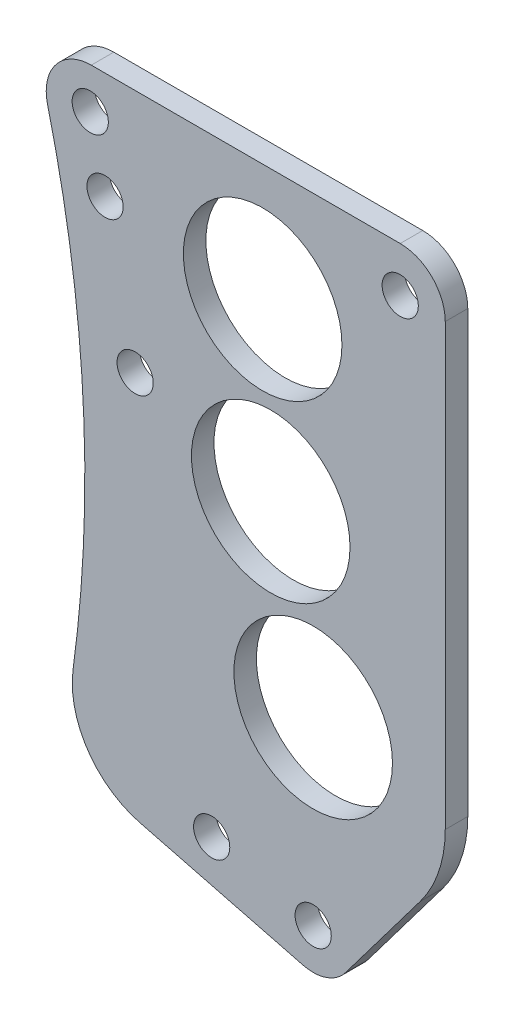
from build123d import *

# Parameters (mm, degrees)
SKETCH2_R           = 2.5527
SKETCH2_R_2         = 11.176
BOSS_EXTRUDE1_DEPTH = 3.175


with BuildPart() as part:
    # Sketch2 → Boss-Extrude1 (new body)
    with BuildSketch(Plane.XY):
        with BuildLine():
            Line((89.804840449, 162.158224077), (133.35, 162.158224077))
            ThreePointArc((133.35, 162.158224077), (137.840128061, 160.298352138), (139.7, 155.808224077))
            Line((139.7, 155.808224077), (139.7, 93.800599977))
            ThreePointArc((139.7, 93.800599977), (138.794482451, 88.24423856), (136.171639749, 83.262892317))
            Line((136.171639749, 83.262892317), (125.655155155, 69.319391612))
            ThreePointArc((125.655155155, 69.319391612), (122.975635879, 67.362639494), (119.660773298, 67.219851313))
            Line((119.660773298, 67.219851313), (96.672878026, 73.109258508))
            ThreePointArc((96.672878026, 73.109258508), (89.283742308, 78.328372298), (87.243120334, 87.141676865))
            ThreePointArc((87.243120334, 87.141676865), (88.644839635, 120.88029943), (83.642604572, 154.275465457))
            ThreePointArc((83.642604572, 154.275465457), (84.802065357, 159.719073266), (89.804840449, 162.158224077))
        make_face()
        with Locations((89.657841737, 156.395094021)):
            Circle(SKETCH2_R, mode=Mode.SUBTRACT)
        with Locations((91.747700228, 147.102187237)):
            Circle(SKETCH2_R, mode=Mode.SUBTRACT)
        with Locations((106.775437357, 76.433708644)):
            Circle(SKETCH2_R, mode=Mode.SUBTRACT)
        with Locations((115.1001, 121.545060726)):
            Circle(SKETCH2_R_2, mode=Mode.SUBTRACT)
        with Locations((113.962375762, 145.648224077)):
            Circle(SKETCH2_R_2, mode=Mode.SUBTRACT)
        with Locations((133.35, 155.808224077)):
            Circle(SKETCH2_R, mode=Mode.SUBTRACT)
        with Locations((95.988414932, 127.701170501)):
            Circle(SKETCH2_R, mode=Mode.SUBTRACT)
        with Locations((121.082277384, 72.768353221)):
            Circle(SKETCH2_R, mode=Mode.SUBTRACT)
        with Locations((121.082277384, 98.168353221)):
            Circle(SKETCH2_R_2, mode=Mode.SUBTRACT)
    extrude(amount=BOSS_EXTRUDE1_DEPTH)


solid = part.part
